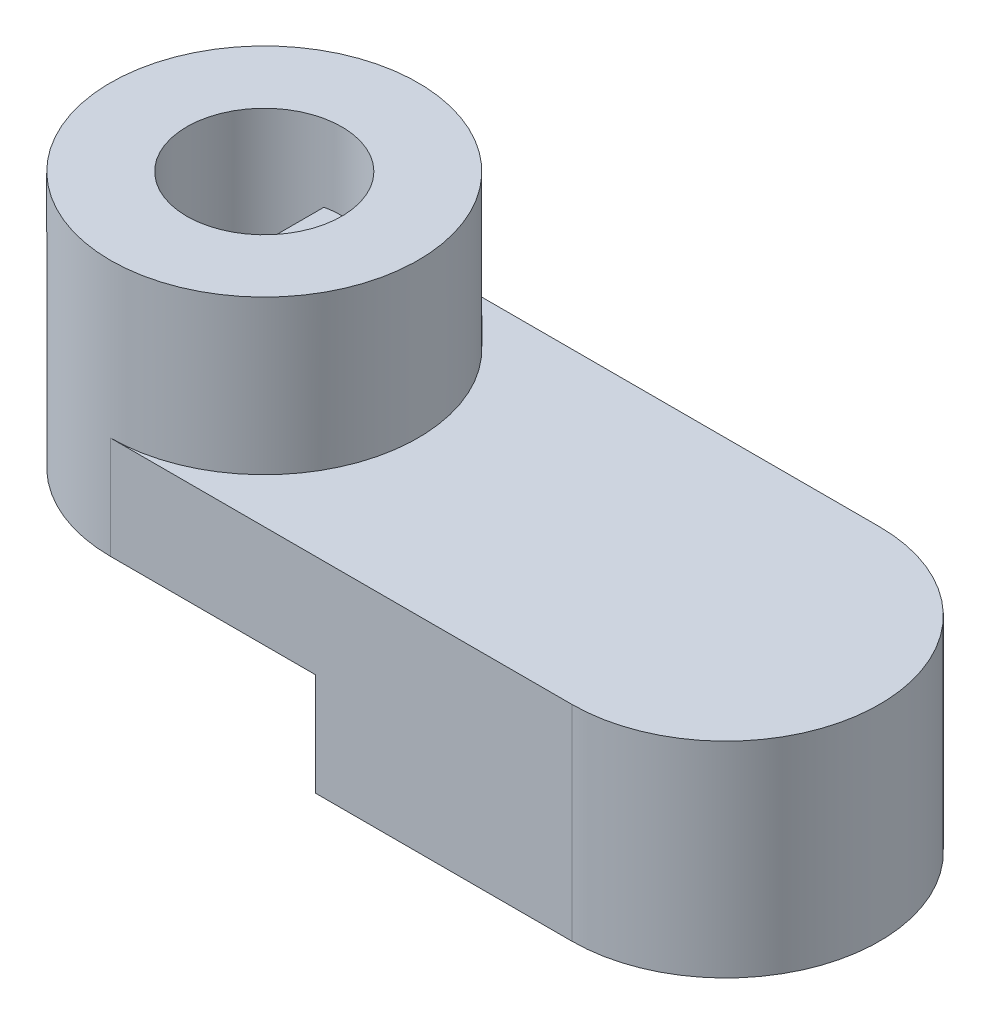
from build123d import *

# Parameters (mm, degrees)
BOSS_EXTRUDE1_DEPTH = 4.7625
CUT_EXTRUDE2_REACH  = 27.101
SKETCH5_R           = 4.7625
SKETCH5_R_2         = 2.4
BOSS_EXTRUDE2_DEPTH = 4.7625
BOSS_EXTRUDE3_DEPTH = 2.38125


with BuildPart() as part:
    # Sketch1 → Boss-Extrude1 (new, symmetric)
    with BuildSketch(Plane.XY):
        Polygon((0, 0), (-12.7, 0), (-12.7, 3.175), (-23.8125, 3.175), (-23.8125, 6.35), (0, 6.35), align=None)
    extrude(amount=BOSS_EXTRUDE1_DEPTH, both=True)

    # Sketch3 → Cut-Extrude2 (cut, up to next)
    with BuildSketch(Plane.XZ, mode=Mode.PRIVATE) as cut_extrude2_sk1:
        with BuildLine():
            ThreePointArc((-19.05, -4.7625), (-22.417596045, -3.367596045), (-23.8125, 0))
            Line((-23.8125, 0), (-23.8125, -4.7625))
            Line((-23.8125, -4.7625), (-19.05, -4.7625))
        make_face()
    cut_extrude2_tool1 = extrude(cut_extrude2_sk1.sketch, amount=-CUT_EXTRUDE2_REACH, mode=Mode.PRIVATE) & part.part
    # Sketch3 → Cut-Extrude2 (cut, up to next)
    with BuildSketch(Plane.XZ, mode=Mode.PRIVATE) as cut_extrude2_sk2:
        with BuildLine():
            Line((-23.8125, 4.7625), (-23.8125, 0))
            ThreePointArc((-23.8125, 0), (-22.417596045, 3.367596045), (-19.05, 4.7625))
            Line((-19.05, 4.7625), (-23.8125, 4.7625))
        make_face()
    cut_extrude2_tool2 = extrude(cut_extrude2_sk2.sketch, amount=-CUT_EXTRUDE2_REACH, mode=Mode.PRIVATE) & part.part
    # Sketch3 → Cut-Extrude2 (cut, up to next)
    with BuildSketch(Plane.XZ, mode=Mode.PRIVATE) as cut_extrude2_sk3:
        with BuildLine():
            Line((0, -4.7625), (0, 0))
            ThreePointArc((0, 0), (-1.394903955, -3.367596045), (-4.7625, -4.7625))
            Line((-4.7625, -4.7625), (0, -4.7625))
        make_face()
    cut_extrude2_tool3 = extrude(cut_extrude2_sk3.sketch, amount=-CUT_EXTRUDE2_REACH, mode=Mode.PRIVATE) & part.part
    # Sketch3 → Cut-Extrude2 (cut, up to next)
    with BuildSketch(Plane.XZ, mode=Mode.PRIVATE) as cut_extrude2_sk4:
        with BuildLine():
            Line((0, 4.7625), (-4.7625, 4.7625))
            ThreePointArc((-4.7625, 4.7625), (-1.394903955, 3.367596045), (0, 0))
            Line((0, 0), (0, 4.7625))
        make_face()
    cut_extrude2_tool4 = extrude(cut_extrude2_sk4.sketch, amount=-CUT_EXTRUDE2_REACH, mode=Mode.PRIVATE) & part.part
    add(cut_extrude2_tool1.solids().sort_by_distance((-22.74871, 0, -3.69871))[0], mode=Mode.SUBTRACT)
    add(cut_extrude2_tool2.solids().sort_by_distance((-22.74871, 0, 3.69871))[0], mode=Mode.SUBTRACT)
    add(cut_extrude2_tool3.solids().sort_by_distance((-1.06379, 0, -3.69871))[0], mode=Mode.SUBTRACT)
    add(cut_extrude2_tool4.solids().sort_by_distance((-1.06379, 0, 3.69871))[0], mode=Mode.SUBTRACT)

    # Sketch5 → Boss-Extrude2 (add)
    with BuildSketch(Plane(origin=(0, 6.35, 0), x_dir=(1, 0, 0), z_dir=(0, 1, 0))):
        with Locations((-19.05, 0)):
            Circle(SKETCH5_R)
        with Locations((-19.05, 0)):
            Circle(SKETCH5_R_2, mode=Mode.SUBTRACT)
    extrude(amount=BOSS_EXTRUDE2_DEPTH)

    # Sketch6 → Boss-Extrude3 (add)
    with BuildSketch(Plane(origin=(0, 6.35, 0), x_dir=(1, 0, 0), z_dir=(0, 1, 0))):
        with BuildLine():
            Line((-19.55, -2.347338919), (-19.55, 2.347338919))
            ThreePointArc((-19.55, 2.347338919), (-19.05, 2.4), (-18.55, 2.347338919))
            Line((-18.55, 2.347338919), (-18.55, -2.347338919))
            ThreePointArc((-18.55, -2.347338919), (-19.05, -2.4), (-19.55, -2.347338919))
        make_face()
    extrude(amount=BOSS_EXTRUDE3_DEPTH)


solid = part.part
